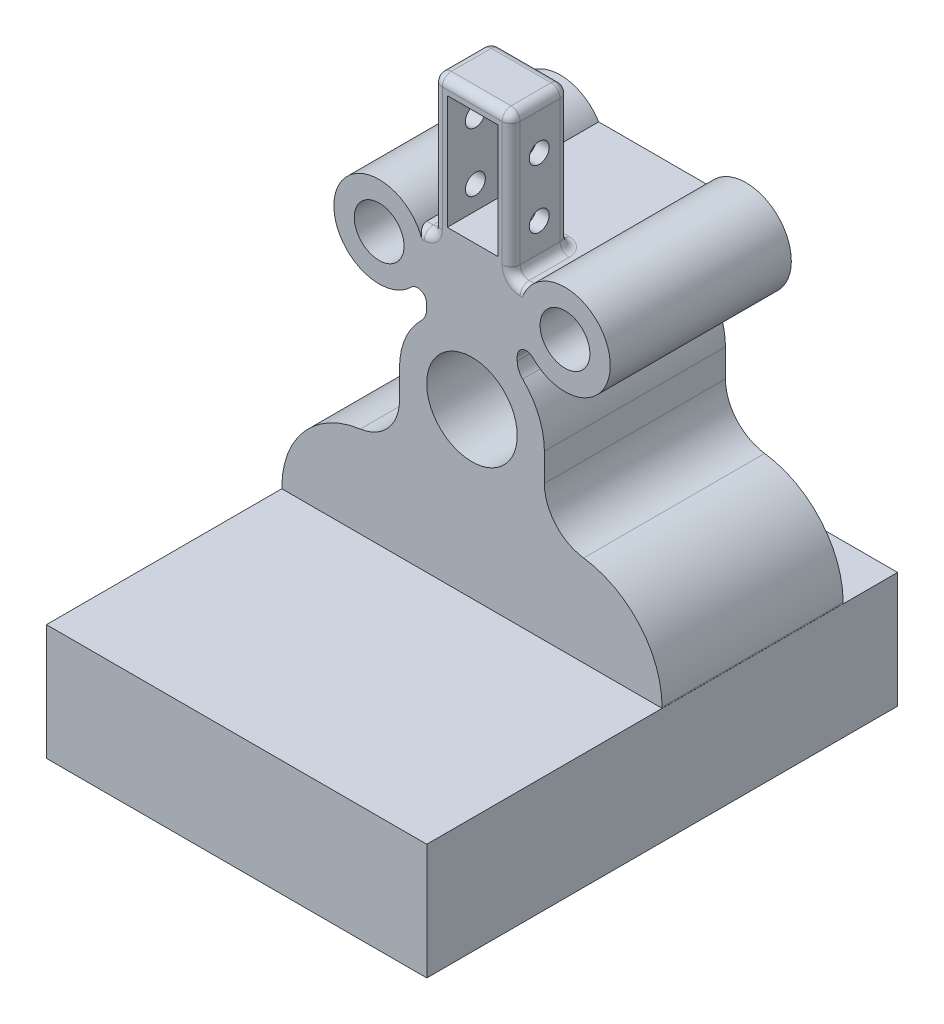
from build123d import *

# Parameters (mm, degrees)
CROQUIS1_R                 = 5
CROQUIS1_R_2               = 2.75
SALIENTE_EXTRUIR1_DEPTH    = 20
SALIENTE_EXTRUIR4_DEPTH    = 10
CROQUIS7_W                 = 42
CROQUIS7_H                 = 10
EXTRUIR_L_MINA1_DEPTH      = 20
CROQUIS8_W                 = 42.01139879
CROQUIS8_H                 = 12.793457143
SALIENTE_EXTRUIR6_DEPTH    = 26
REDONDEO1_R                = 2
REDONDEO2_R                = 1
CROQUIS9_W                 = 8.6
CROQUIS9_H                 = 15.7
CROQUIS9_W_2               = 5.6
CROQUIS9_H_2               = 12.6
SALIENTE_EXTRUIR7_DEPTH    = 6.4
CORTAR_EXTRUIR1_DEPTH      = 70.406702341
CORTAR_EXTRUIR1_DEPTH_BACK = 70.406702341
CROQUIS11_R                = 1.1
REDONDEO3_R                = 1
REDONDEO4_R                = 5
REDONDEO5_R                = 10


# Some blends are built 0.0001 mm under size
with BuildPart() as part:
    # Croquis1 → Saliente-Extruir1 (new body)
    with BuildSketch(Plane.XY):
        with BuildLine():
            Line((-5.025921035, -5.26753442), (-5.025921035, -8.26753442))
            ThreePointArc((-5.025921035, -8.26753442), (-0.025921035, -22.512532419), (4.974078965, -8.26753442))
            Line((4.974078965, -8.26753442), (4.974078965, -5.26753442))
            Line((4.974078965, -5.26753442), (5.974078965, -5.26753442))
            ThreePointArc((5.974078965, -5.26753442), (15.249563623, -2.724799651), (6.025921035, 0))
            Line((6.025921035, 0), (5.025921035, 0))
            Line((5.025921035, 0), (-5.025921035, 0))
            Line((-5.025921035, 0), (-6.025921035, 0))
            ThreePointArc((-6.025921035, 0), (-15.276011655, -2.63376721), (-6.025921035, -5.26753442))
            Line((-6.025921035, -5.26753442), (-5.025921035, -5.26753442))
        make_face()
        with Locations((-0.025921035, -14.512532419)):
            Circle(CROQUIS1_R, mode=Mode.SUBTRACT)
        with Locations((-10.276011655, -2.63376721)):
            Circle(CROQUIS1_R_2, mode=Mode.SUBTRACT)
        with Locations(Location((10.249805759, -2.675592988, 0), (0, 0, 180))):
            Circle(CROQUIS1_R_2, mode=Mode.SUBTRACT)
    extrude(amount=SALIENTE_EXTRUIR1_DEPTH)

    # Croquis5 → Saliente-Extruir4 (add, symmetric)
    with BuildSketch(Plane(origin=(0, 0, 10), x_dir=(-1, 0, 0), z_dir=(0, 0, -1))):
        with BuildLine():
            Line((-7.974078965, -14.512532419), (-7.974078965, -32.592532419))
            Line((-7.974078965, -32.592532419), (8.025921035, -32.592532419))
            Line((8.025921035, -32.592532419), (8.025921035, -14.512532419))
            ThreePointArc((8.025921035, -14.512532419), (0.025921035, -22.512532419), (-7.974078965, -14.512532419))
        make_face()
    extrude(amount=SALIENTE_EXTRUIR4_DEPTH, both=True)

    # Croquis7 → Extruir-Lámina1 (add)
    with BuildSketch(Plane.XY.offset(20)):
        with Locations((-0.025921035, -27.592532419)):
            Rectangle(CROQUIS7_W, CROQUIS7_H)
    extrude(amount=-EXTRUIR_L_MINA1_DEPTH)

    # Croquis8 → Saliente-Extruir6 (add, symmetric)
    with BuildSketch(Plane.XY.offset(20)):
        with Locations((-0.02022164, -38.989260991)):
            Rectangle(CROQUIS8_W, CROQUIS8_H)
    extrude(amount=SALIENTE_EXTRUIR6_DEPTH, both=True)

    # Redondeo1
    # the kernel refuses this fillet: 2 mm, written as the material it adds along each edge
    with BuildSketch(Plane(origin=(-5.025921035, -8.26753442, 0), x_dir=(0, 1, 0), z_dir=(0, 0, 1))) as redondeo1_piece_1:
        with BuildLine():
            CenterArc((0.89643043, 2), REDONDEO1_R, 224.427004001, 45.572995999)
            Line((-0.531855256, 0.6), (-0.560420969, 0.572))
            ThreePointArc((-0.560420969, 0.572), (-0.288339065, 0.280133933), (-0.03122499, -0.025))
            Line((-0.03122499, -0.025), (0, -0.04))
            Line((0, -0.04), (0.89643043, -0.04))
            Line((0.89643043, -0.04), (0.89643043, 0))
        make_face()
    extrude(amount=20)
    with BuildSketch(Plane(origin=(4.974078965, -8.26753442, 0), x_dir=(0.7483239866610061, -0.6633334086172491, 0), z_dir=(0, 0, 1))) as redondeo1_piece_2:
        with BuildLine():
            CenterArc((0.902015721, 1.99748721), REDONDEO1_R, 221.554595727, 45.572995999)
            Line((-0.594632253, 0.670820393), (-0.624565212, 0.644287057))
            Line((-0.624565212, 0.644287057), (-0.029932959, -0.026533336))
            Line((-0.029932959, -0.026533336), (0.002004479, -0.039949744))
            ThreePointArc((0.002004479, -0.039949744), (0.400895876, -0.029948842), (0.799787272, -0.039949744))
            Line((0.799787272, -0.039949744), (0.801791752, 0))
        make_face()
    extrude(amount=20)
    with BuildSketch(Plane(origin=(-5.025921035, -5.26753442, 0), x_dir=(-1, 0, 0), z_dir=(0, 0, 1))) as redondeo1_piece_3:
        with BuildLine():
            CenterArc((2, 1.732050808), REDONDEO1_R, 180, 60)
            Line((0, 1.732050808), (-0.04, 1.732050808))
            Line((-0.04, 1.732050808), (-0.04, 0))
            Line((-0.04, 0), (0, -0.04))
            ThreePointArc((0, -0.04), (0.5, -0.04), (0.98, -0.034641016))
            Line((0.98, -0.034641016), (1, 0))
        make_face()
    extrude(amount=20)
    with BuildSketch(Plane(origin=(4.974078965, -5.26753442, 0), x_dir=(0, -1, 0), z_dir=(0, 0, 1))) as redondeo1_piece_4:
        with BuildLine():
            CenterArc((1.732050808, 2), REDONDEO1_R, 210, 60)
            Line((0, 1), (-0.034641016, 0.98))
            ThreePointArc((-0.034641016, 0.98), (-0.04, 0.5), (-0.04, 0))
            Line((-0.04, 0), (0, -0.04))
            Line((0, -0.04), (1.732050808, -0.04))
            Line((1.732050808, -0.04), (1.732050808, 0))
        make_face()
    extrude(amount=20)

    # Redondeo2
    redondeo2_edges = [part.edges().sort_by_distance(p)[0] for p in [
        (-6.025921035, -5.26753442, 10),
        (5.974078965, -5.26753442, 10),
    ]]
    fillet(redondeo2_edges, radius=REDONDEO2_R)

    # Croquis9 → Saliente-Extruir7 (add)
    with BuildSketch(Plane.XY.offset(20)):
        with Locations((0, 7.85)):
            Rectangle(CROQUIS9_W, CROQUIS9_H)
        with Locations((0.05, 7.85)):
            Rectangle(CROQUIS9_W_2, CROQUIS9_H_2, mode=Mode.SUBTRACT)
    extrude(amount=-SALIENTE_EXTRUIR7_DEPTH)

    # Croquis11 → Cortar-Extruir1 (cut, two sides: drawn at the far end of the back side and taken through both)
    with BuildSketch(Plane(origin=(4.3, 0, 0), x_dir=(0, 0, -1), z_dir=(1, 0, 0)).offset(-CORTAR_EXTRUIR1_DEPTH_BACK)):
        with Locations(Location((-16.899272709, 10.65, 0), (0, 0, 90))):
            Circle(CROQUIS11_R)
        with Locations(Location((-16.899272709, 4.15, 0), (0, 0, 90))):
            Circle(CROQUIS11_R)
    extrude(amount=CORTAR_EXTRUIR1_DEPTH + CORTAR_EXTRUIR1_DEPTH_BACK, mode=Mode.SUBTRACT)

    # Redondeo3
    redondeo3_edges = [part.edges().sort_by_distance(p)[0] for p in [
        (-5.162960517, 0, 20),
        (4.3, 7.85, 13.6),
        (4.3, 15.7, 16.8),
        (0, 0, 13.6),
        (4.3, 0, 16.8),
        (-4.3, 7.85, 13.6),
        (-4.3, 0, 16.8),
        (0, 15.7, 13.6),
        (-4.3, 15.7, 16.8),
        (4.3, 7.85, 20),
        (0, 15.7, 20),
        (-4.3, 7.85, 20),
        (5.162960517, 0, 20),
    ]]
    fillet(redondeo3_edges, radius=REDONDEO3_R)

    # Redondeo4
    redondeo4_edges = [part.edges().sort_by_distance(p)[0] for p in [
        (-8.025921035, -22.592532419, 10),
        (7.974078965, -22.592532419, 10),
    ]]
    fillet(redondeo4_edges, radius=REDONDEO4_R)

    # Redondeo5
    redondeo5_edges = [part.edges().sort_by_distance(p)[0] for p in [
        (-21.025921035, -22.592532419, 10),
        (20.974078965, -22.592532419, 10),
    ]]
    fillet(redondeo5_edges, radius=REDONDEO5_R - 0.0001)  # a hair under: the kernel refuses the full size


solid = part.part
